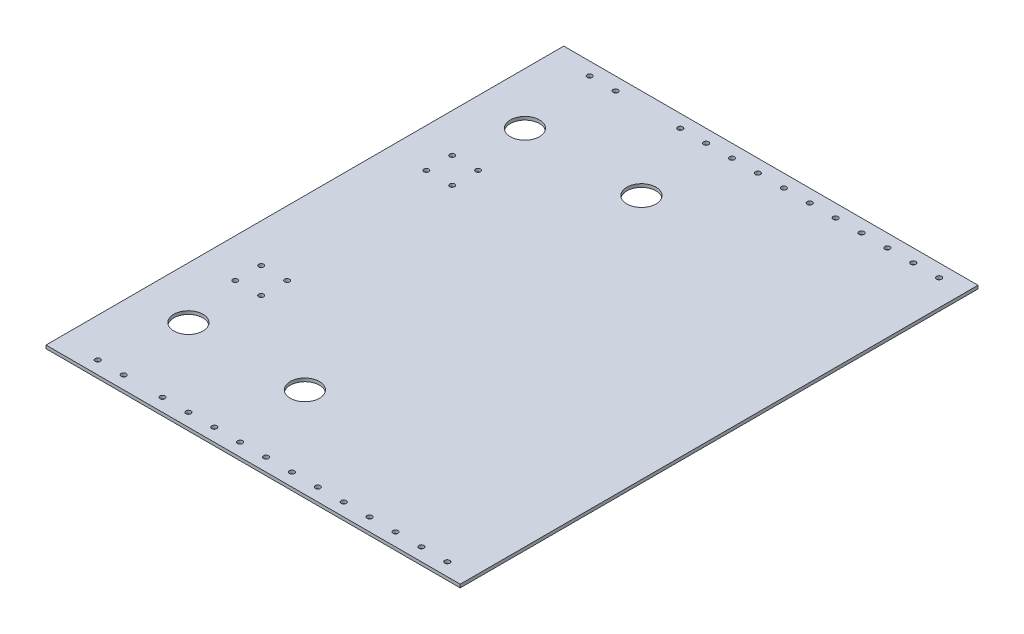
from build123d import *

# Parameters (mm, degrees)
SKETCH1_W               = 406.4
SKETCH1_H               = 508
BOSS_EXTRUDE1_DEPTH     = 3.175
SKETCH2_R               = 14.2875
CUT_EXTRUDE1_DEPTH      = 3.175
CUT_EXTRUDE2_DEPTH      = 651.56517016
CUT_EXTRUDE2_DEPTH_BACK = 651.56517016
SKETCH3_R               = 2.4892
CUT_EXTRUDE3_DEPTH      = 651.56517016
CUT_EXTRUDE3_DEPTH_BACK = 651.56517016
SKETCH4_R               = 2.413


with BuildPart() as part:
    # Sketch1 → Boss-Extrude1 (new body)
    with BuildSketch(Plane(origin=(0, 0, 0), x_dir=(1, 0, 0), z_dir=(0, 1, 0))):
        with Locations((203.2, 254)):
            Rectangle(SKETCH1_W, SKETCH1_H)
    extrude(amount=BOSS_EXTRUDE1_DEPTH)

    # Sketch2 → Cut-Extrude1 (cut)
    with BuildSketch(Plane(origin=(0, 3.175, 0), x_dir=(1, 0, 0), z_dir=(0, 1, 0))):
        with Locations((50.8, 419.1)):
            Circle(SKETCH2_R)
        with Locations((165.1, 419.1)):
            Circle(SKETCH2_R)
        with Locations((50.8, 88.9)):
            Circle(SKETCH2_R)
        with Locations((165.1, 88.9)):
            Circle(SKETCH2_R)
    extrude(amount=-CUT_EXTRUDE1_DEPTH, mode=Mode.SUBTRACT)

    # Sketch3 → Cut-Extrude2 (cut, two sides: drawn at the far end of the back side and taken through both)
    with BuildSketch(Plane(origin=(0, 3.175, 0), x_dir=(1, 0, 0), z_dir=(0, 1, 0)).offset(-CUT_EXTRUDE2_DEPTH_BACK)):
        with Locations((38.1, 12.7)):
            Circle(SKETCH3_R)
        with Locations((63.5, 12.7)):
            Circle(SKETCH3_R)
        with Locations((127, 12.7)):
            Circle(SKETCH3_R)
        with Locations((152.4, 12.7)):
            Circle(SKETCH3_R)
        with Locations((177.8, 12.7)):
            Circle(SKETCH3_R)
        with Locations((203.2, 12.7)):
            Circle(SKETCH3_R)
        with Locations((228.6, 12.7)):
            Circle(SKETCH3_R)
        with Locations((254, 12.7)):
            Circle(SKETCH3_R)
        with Locations((279.4, 12.7)):
            Circle(SKETCH3_R)
        with Locations((304.8, 12.7)):
            Circle(SKETCH3_R)
        with Locations((330.2, 12.7)):
            Circle(SKETCH3_R)
        with Locations((355.6, 12.7)):
            Circle(SKETCH3_R)
        with Locations((381, 12.7)):
            Circle(SKETCH3_R)
        with Locations((381, 495.3)):
            Circle(SKETCH3_R)
        with Locations((355.6, 495.3)):
            Circle(SKETCH3_R)
        with Locations((330.2, 495.3)):
            Circle(SKETCH3_R)
        with Locations((304.8, 495.3)):
            Circle(SKETCH3_R)
        with Locations((279.4, 495.3)):
            Circle(SKETCH3_R)
        with Locations((254, 495.3)):
            Circle(SKETCH3_R)
        with Locations((228.6, 495.3)):
            Circle(SKETCH3_R)
        with Locations((203.2, 495.3)):
            Circle(SKETCH3_R)
        with Locations((177.8, 495.3)):
            Circle(SKETCH3_R)
        with Locations((152.4, 495.3)):
            Circle(SKETCH3_R)
        with Locations((127, 495.3)):
            Circle(SKETCH3_R)
        with Locations((63.5, 495.3)):
            Circle(SKETCH3_R)
        with Locations((38.1, 495.3)):
            Circle(SKETCH3_R)
        with Locations((101.6, 12.7)):
            Circle(SKETCH3_R)
    extrude(amount=CUT_EXTRUDE2_DEPTH + CUT_EXTRUDE2_DEPTH_BACK, mode=Mode.SUBTRACT)

    # Sketch4 → Cut-Extrude3 (cut, two sides: drawn at the far end of the back side and taken through both)
    with BuildSketch(Plane.XZ.offset(-CUT_EXTRUDE3_DEPTH_BACK)):
        with Locations((38.179625472, -334.938702735)):
            Circle(SKETCH4_R)
        with Locations((63.579625472, -334.938702735)):
            Circle(SKETCH4_R)
        with Locations((63.579625472, -360.338702735)):
            Circle(SKETCH4_R)
        with Locations((38.179625472, -360.338702735)):
            Circle(SKETCH4_R)
        with Locations((63.461499211, -173.060090351)):
            Circle(SKETCH4_R)
        with Locations((38.061499211, -173.060090351)):
            Circle(SKETCH4_R)
        with Locations((38.061499211, -147.660090351)):
            Circle(SKETCH4_R)
        with Locations((63.461499211, -147.660090351)):
            Circle(SKETCH4_R)
    extrude(amount=CUT_EXTRUDE3_DEPTH + CUT_EXTRUDE3_DEPTH_BACK, mode=Mode.SUBTRACT)


solid = part.part
